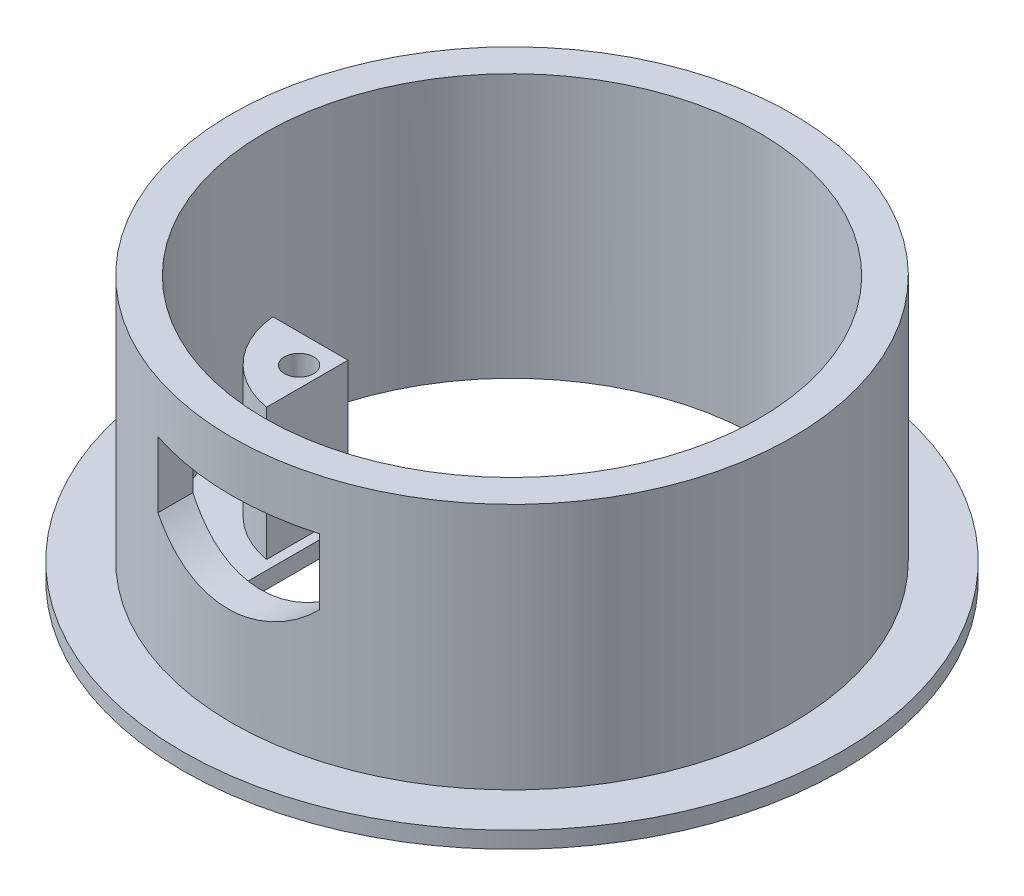
from build123d import *

# Parameters (mm, degrees)
SKETCH1_R           = 40
SKETCH1_R_2         = 30
BOSS_EXTRUDE1_DEPTH = 2
SKETCH2_R           = 34
SKETCH2_R_2         = 30
BOSS_EXTRUDE2_DEPTH = 30
BOSS_EXTRUDE3_DEPTH = 2
CUT_EXTRUDE1_DEPTH  = 7
BOSS_EXTRUDE4_DEPTH = 16
SKETCH12_R          = 1.775
CUT_EXTRUDE2_DEPTH  = 9
CUT_EXTRUDE3_DEPTH  = 10


with BuildPart() as part:
    # Sketch1 → Boss-Extrude1 (new body)
    with BuildSketch(Plane(origin=(0, 0, 0), x_dir=(1, 0, 0), z_dir=(0, 1, 0))):
        Circle(SKETCH1_R)
        Circle(SKETCH1_R_2, mode=Mode.SUBTRACT)
    extrude(amount=BOSS_EXTRUDE1_DEPTH)

    # Sketch2 → Boss-Extrude2 (add)
    with BuildSketch(Plane(origin=(0, 2, 0), x_dir=(1, 0, 0), z_dir=(0, 1, 0))):
        Circle(SKETCH2_R)
        Circle(SKETCH2_R_2, mode=Mode.SUBTRACT)
    extrude(amount=BOSS_EXTRUDE2_DEPTH)

    # Sketch9 → Boss-Extrude3 (add)
    with BuildSketch(Plane(origin=(0, 0, 0), x_dir=(1, 0, 0), z_dir=(0, 1, 0))):
        with BuildLine():
            Line((-29.865737826, -2.835084495), (29.865737826, -2.835084495))
            ThreePointArc((29.865737826, -2.835084495), (20.185978613, -22.192932826), (0, -30))
            ThreePointArc((0, -30), (-20.185978613, -22.192932826), (-29.865737826, -2.835084495))
        make_face()
    extrude(amount=BOSS_EXTRUDE3_DEPTH)

    # Sketch10 → Cut-Extrude1 (cut)
    with BuildSketch(Plane.XY.offset(35)):
        with BuildLine():
            Line((-10.668263465, 25.889544809), (9.331736535, 25.889544809))
            Line((9.331736535, 25.889544809), (9.331736535, 17.889544809))
            ThreePointArc((9.331736535, 17.889544809), (-0.668263465, 13.747409185), (-10.668263465, 17.889544809))
            Line((-10.668263465, 17.889544809), (-10.668263465, 25.889544809))
        make_face()
    extrude(amount=-CUT_EXTRUDE1_DEPTH, mode=Mode.SUBTRACT)

    # Sketch11 → Boss-Extrude4 (add)
    with BuildSketch(Plane(origin=(0, 2, 0), x_dir=(1, 0, 0), z_dir=(0, 1, 0))):
        with BuildLine():
            Line((-24.173456416, -4.835084495), (-15.0625297, -4.835084495))
            Line((-15.0625297, -4.835084495), (-15.0625297, -14.717703762))
            ThreePointArc((-15.0625297, -14.717703762), (-21.294330348, -11.321833226), (-24.173456416, -4.835084495))
        make_face()
        with BuildLine():
            Line((24.173456416, -4.835084495), (15.0625297, -4.835084495))
            Line((15.0625297, -4.835084495), (15.0625297, -14.717703762))
            ThreePointArc((15.0625297, -14.717703762), (21.294330348, -11.321833226), (24.173456416, -4.835084495))
        make_face()
    extrude(amount=BOSS_EXTRUDE4_DEPTH)

    # Sketch12 → Cut-Extrude2 (cut)
    with BuildSketch(Plane(origin=(0, 18, 0), x_dir=(1, 0, 0), z_dir=(0, 1, 0))):
        with Locations((-17.5, -8.335084495)):
            Circle(SKETCH12_R)
        with Locations((17.5, -8.335084495)):
            Circle(SKETCH12_R)
    extrude(amount=-CUT_EXTRUDE2_DEPTH, mode=Mode.SUBTRACT)

    # Sketch13 → Cut-Extrude3 (cut)
    with BuildSketch(Plane(origin=(0, 2, 0), x_dir=(1, 0, 0), z_dir=(0, 1, 0))):
        with BuildLine():
            Line((-13.918444603, -20.880652704), (-13.918444603, 1.119347296))
            Line((-13.918444603, 1.119347296), (14.081555397, 1.119347296))
            Line((14.081555397, 1.119347296), (14.081555397, -20.880652704))
            ThreePointArc((14.081555397, -20.880652704), (0.081555397, -27.349053727), (-13.918444603, -20.880652704))
        make_face()
    extrude(amount=-CUT_EXTRUDE3_DEPTH, mode=Mode.SUBTRACT)


solid = part.part
